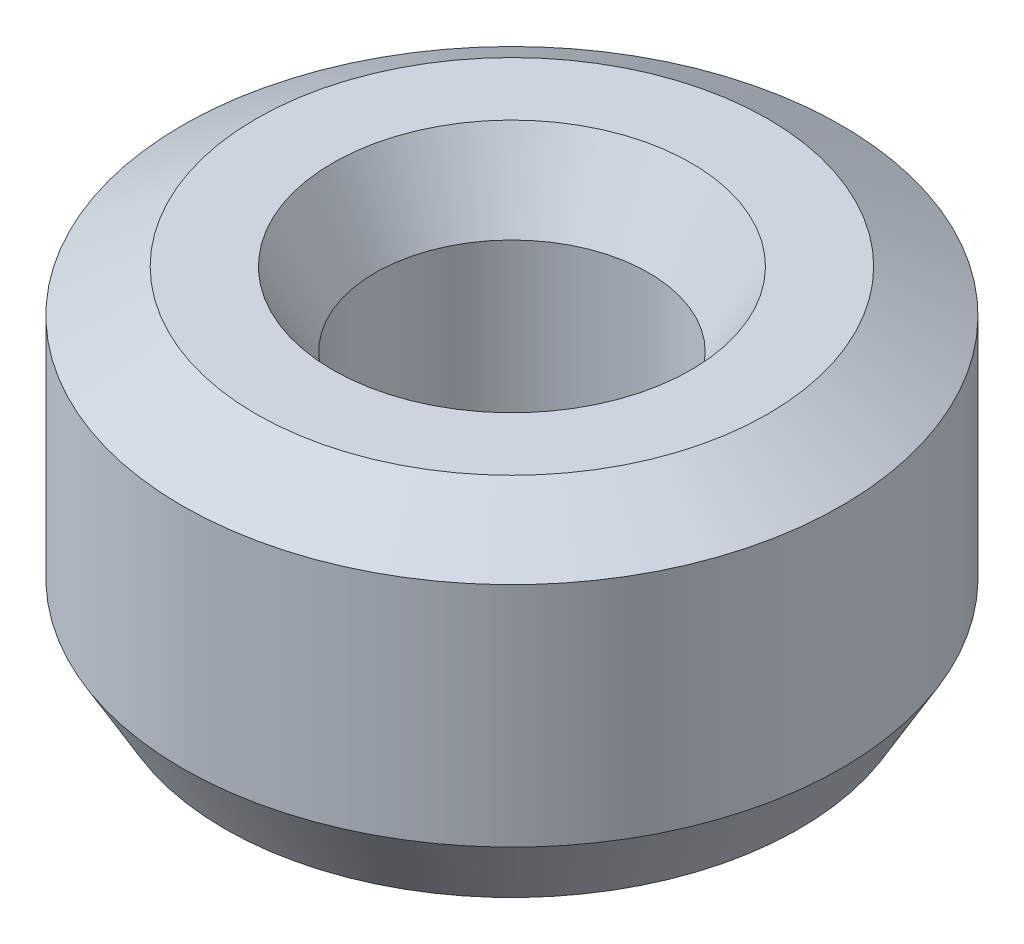
from build123d import *
from OCP.BRepFilletAPI import BRepFilletAPI_MakeChamfer

# Parameters (mm, degrees)
SKETCH1_R           = 22.5
BOSS_EXTRUDE1_DEPTH = 23.462652125
SKETCH2_R           = 9.331633569
CUT_EXTRUDE1_DEPTH  = 40.534744779
CHAMFER1_SIZE       = 2.907215045
CHAMFER1_SIZE2      = 5.035444166


with BuildPart() as part:
    # Sketch1 → Boss-Extrude1 (new body)
    with BuildSketch(Plane(origin=(0, 0, 0), x_dir=(1, 0, 0), z_dir=(0, 1, 0))):
        Circle(SKETCH1_R)
    extrude(amount=BOSS_EXTRUDE1_DEPTH)

    # Sketch2 → Cut-Extrude1 (cut, through all)
    with BuildSketch(Plane(origin=(0, 0, 0), x_dir=(1, 0, 0), z_dir=(0, 1, 0))):
        Circle(SKETCH2_R)
    extrude(amount=CUT_EXTRUDE1_DEPTH, mode=Mode.SUBTRACT)

    # Chamfer1: one chamfer whose edges measure the first distance from different faces: ONE call of the kernel's chamfer builder (chamfer() names one face for all edges)
    chamfer1_edges_1 = [part.edges().sort_by_distance(p)[0] for p in [
        (-9.331633569, 23.462652125, 0),
    ]]
    chamfer1_side_1 = [part.faces().sort_by_distance(p)[0] for p in [
        (-21.863603897, 23.462652125, 0),
    ]]
    chamfer1_edges_2 = [part.edges().sort_by_distance(p)[0] for p in [
        (-9.331633569, 0, 0),
    ]]
    chamfer1_side_2 = [part.faces().sort_by_distance(p)[0] for p in [
        (-9.331633569, 11.731326063, 0),
    ]]
    chamfer1_edges_3 = [part.edges().sort_by_distance(p)[0] for p in [
        (-22.5, 0, 0),
    ]]
    chamfer1_side_3 = [part.faces().sort_by_distance(p)[0] for p in [
        (-21.863603897, 0, 0),
    ]]
    chamfer1_edges_4 = [part.edges().sort_by_distance(p)[0] for p in [
        (-22.5, 23.462652125, 0),
    ]]
    chamfer1_side_4 = [part.faces().sort_by_distance(p)[0] for p in [
        (-22.5, 11.731326063, 0),
    ]]
    chamfer1 = BRepFilletAPI_MakeChamfer(part.part.solid().wrapped)
    for e in chamfer1_edges_1:
        chamfer1.Add(CHAMFER1_SIZE, CHAMFER1_SIZE2, e.wrapped, chamfer1_side_1[0].wrapped)  # the first distance lies on this face
    for e in chamfer1_edges_2:
        chamfer1.Add(CHAMFER1_SIZE, CHAMFER1_SIZE2, e.wrapped, chamfer1_side_2[0].wrapped)  # the first distance lies on this face
    for e in chamfer1_edges_3:
        chamfer1.Add(CHAMFER1_SIZE, CHAMFER1_SIZE2, e.wrapped, chamfer1_side_3[0].wrapped)  # the first distance lies on this face
    for e in chamfer1_edges_4:
        chamfer1.Add(CHAMFER1_SIZE, CHAMFER1_SIZE2, e.wrapped, chamfer1_side_4[0].wrapped)  # the first distance lies on this face
    add(Compound.cast(chamfer1.Shape()), mode=Mode.REPLACE)


solid = part.part
